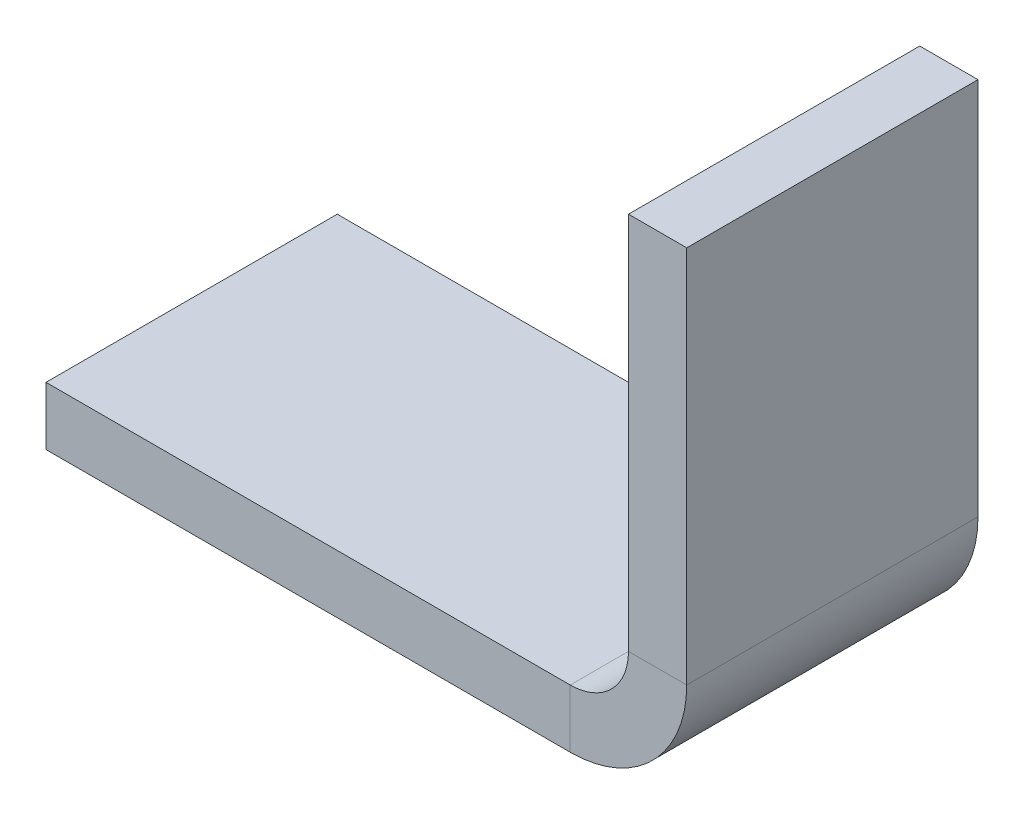
from build123d import *

# Parameters (mm, degrees)
SM_BASE_FLANGE_1_DEPTH = 10


# Sheet-metal steps are written as plain solids
with BuildPart() as part:
    # Sketch 1 → 基体-法兰1 (new body)
    with BuildSketch(Plane.XY):
        with BuildLine():
            Line((0, 0), (18, 0))
            ThreePointArc((18, 0), (19.414213562, 0.585786438), (20, 2))
            Line((20, 2), (20, 15))
            Line((20, 15), (22, 15))
            Line((22, 15), (22, 2))
            ThreePointArc((22, 2), (20.828427125, -0.828427125), (18, -2))
            Line((18, -2), (0, -2))
            Line((0, -2), (0, 0))
        make_face()
    extrude(amount=SM_BASE_FLANGE_1_DEPTH)


solid = part.part
